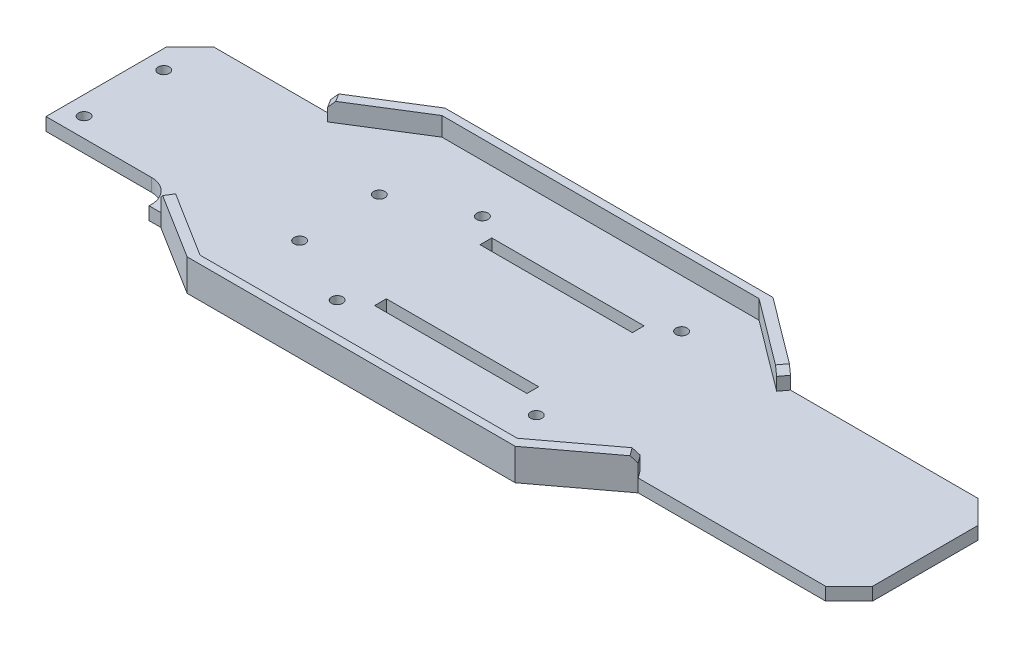
from build123d import *

# Parameters (mm, degrees)
BOSS_EXTRUDE1_DEPTH  = 5.5
CHASSIS_WALLS1_DEPTH = 8
CHAMFER1_SIZE        = 10
CHAMFER2_SIZE        = 10
CHAMFER3_SIZE        = 2.5
SKETCH4_R            = 2.4
CUT_EXTRUDE1_DEPTH   = 10
SKETCH5_W            = 55
SKETCH5_H            = 11
CUT_EXTRUDE2_DEPTH   = 10
SKETCH6_W            = 65
SKETCH6_H            = 5
CUT_EXTRUDE3_DEPTH   = 198.962117588
FILLET1_R            = 10


with BuildPart() as part:
    # Sketch1 → Boss-Extrude1 (new body)
    with BuildSketch(Plane(origin=(0, 0, 0), x_dir=(1, 0, 0), z_dir=(0, 1, 0))):
        Polygon((-100, 36.25), (-70, 55), (70, 55), (100, 32.5), (190, 32.5), (190, -32.5), (100, -32.5), (70, -55), (-70, -55), (-100, -36.25), (-160, -36.25), (-160, 36.25), align=None)
    extrude(amount=BOSS_EXTRUDE1_DEPTH)

    # Sketch3 → Chassis-Walls1 (add)
    with BuildSketch(Plane(origin=(0, 5.5, 0), x_dir=(1, 0, 0), z_dir=(0, 1, 0))):
        Polygon((0, 55), (-70, 55), (-100, 36.25), (-97.88000424, 32.858006784), (-67.88000424, 51.608006784), (0, 51.608006784), (67.456005088, 51.608006784), (97.456005088, 29.108006784), (100, 32.5), (70, 55), align=None)
        Polygon((67.456005088, -51.608006784), (0, -51.608006784), (-67.88000424, -51.608006784), (-97.88000424, -32.858006784), (-100, -36.25), (-70, -55), (0, -55), (70, -55), (100, -32.5), (97.456005088, -29.108006784), align=None)
    extrude(amount=CHASSIS_WALLS1_DEPTH)

    # Chamfer1
    chamfer1_edges = [part.edges().sort_by_distance(p)[0] for p in [
        (-160, 2.75, -36.25),
        (-160, 2.75, 36.25),
    ]]
    chamfer(chamfer1_edges, length=CHAMFER1_SIZE)

    # Chamfer2
    chamfer2_edges = [part.edges().sort_by_distance(p)[0] for p in [
        (190, 2.75, -32.5),
        (190, 2.75, 32.5),
    ]]
    chamfer(chamfer2_edges, length=CHAMFER2_SIZE)

    # Chamfer3
    chamfer3_edges = [part.edges().sort_by_distance(p)[0] for p in [
        (-98.94000212, 13.5, -34.554003392),
        (-98.94000212, 13.5, 34.554003392),
        (98.728002544, 13.5, 30.804003392),
        (98.728002544, 13.5, -30.804003392),
    ]]
    chamfer(chamfer3_edges, length=CHAMFER3_SIZE)

    # Sketch4 → Cut-Extrude1 (cut)
    with BuildSketch(Plane.XZ):
        with Locations((-152, 17)):
            Circle(SKETCH4_R)
        with Locations((-60, 17)):
            Circle(SKETCH4_R)
        with Locations((-60, -17)):
            Circle(SKETCH4_R)
        with Locations((-152, -17)):
            Circle(SKETCH4_R)
        with Locations((-30, 31)):
            Circle(SKETCH4_R)
        with Locations((55, 31)):
            Circle(SKETCH4_R)
        with Locations((55, -31)):
            Circle(SKETCH4_R)
        with Locations((-30, -31)):
            Circle(SKETCH4_R)
    extrude(amount=-CUT_EXTRUDE1_DEPTH, mode=Mode.SUBTRACT)

    # Sketch5 → Cut-Extrude2 (cut)
    with BuildSketch(Plane(origin=(0, 5.5, 0), x_dir=(1, 0, 0), z_dir=(0, 1, 0))):
        with Locations((-132.5, -30.75)):
            Rectangle(SKETCH5_W, SKETCH5_H)
    extrude(amount=-CUT_EXTRUDE2_DEPTH, mode=Mode.SUBTRACT)

    # Sketch6 → Cut-Extrude3 (cut, through all)
    with BuildSketch(Plane(origin=(0, 5.5, 0), x_dir=(1, 0, 0), z_dir=(0, 1, 0))):
        with Locations((12.5, 22.5)):
            Rectangle(SKETCH6_W, SKETCH6_H)
        with Locations((12.5, -22.5)):
            Rectangle(SKETCH6_W, SKETCH6_H)
    extrude(amount=-CUT_EXTRUDE3_DEPTH, mode=Mode.SUBTRACT)

    # Fillet1
    fillet1_edges = [part.edges().sort_by_distance(p)[0] for p in [
        (-105, 2.75, 25.25),
    ]]
    fillet(fillet1_edges, radius=FILLET1_R)


solid = part.part
